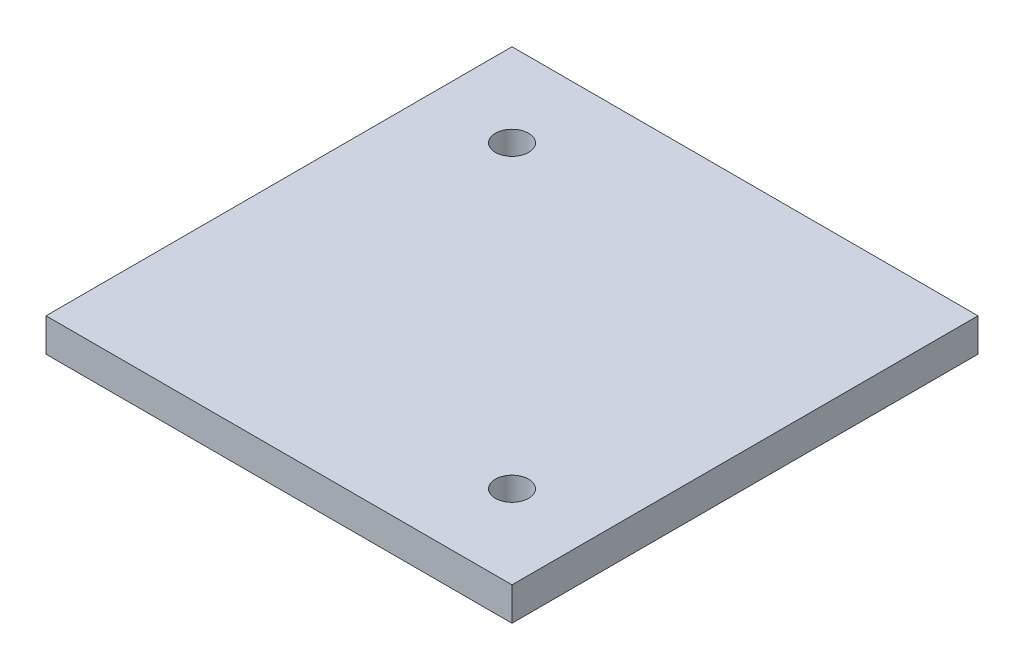
from build123d import *

# Parameters (mm, degrees)
SKETCH1_W           = 44.45
SKETCH1_H           = 44.45
SKETCH1_R           = 1.5875
BOSS_EXTRUDE1_DEPTH = 3.175


with BuildPart() as part:
    # Sketch1 → Boss-Extrude1 (new body)
    with BuildSketch(Plane(origin=(0, 0, 0), x_dir=(1, 0, 0), z_dir=(0, 1, 0))):
        with Locations((22.225, 22.225)):
            Rectangle(SKETCH1_W, SKETCH1_H)
        with Locations((7.9375, 36.5125)):
            Circle(SKETCH1_R, mode=Mode.SUBTRACT)
        with Locations((36.5125, 7.9375)):
            Circle(SKETCH1_R, mode=Mode.SUBTRACT)
    extrude(amount=BOSS_EXTRUDE1_DEPTH)


solid = part.part
